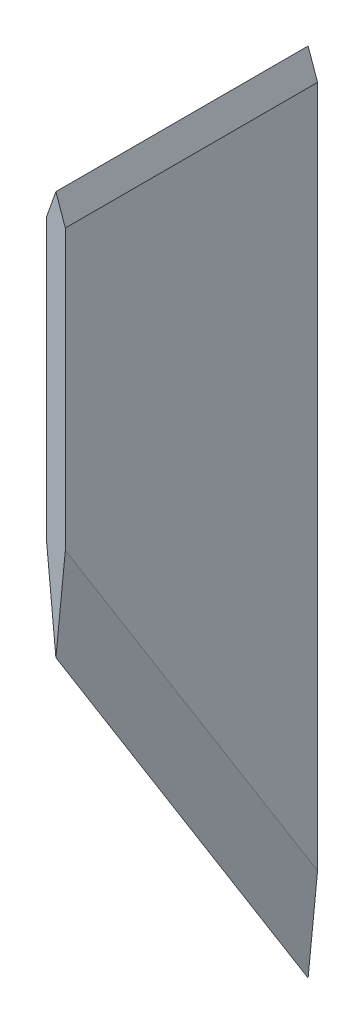
from build123d import *

# Parameters (mm, degrees)
BOSS_EXTRUDE1_DEPTH     = 4.7625
CUT_EXTRUDE1_DEPTH      = 120.906177515
CUT_EXTRUDE1_DEPTH_BACK = 120.906177515
CUT_EXTRUDE2_DEPTH      = 213.944056987
CUT_EXTRUDE2_DEPTH_BACK = 213.944056987


with BuildPart() as part:
    # Sketch1 → Boss-Extrude1 (new body)
    with BuildSketch(Plane.YZ):
        Polygon((0, 0), (203.2, 0), (203.2, 63.5), (101.6, 63.5), align=None)
    extrude(amount=BOSS_EXTRUDE1_DEPTH)

    # Sketch2 → Cut-Extrude1 (cut, two sides: drawn at the far end of the back side and taken through both)
    with BuildSketch(Plane(origin=(0, 101.6, 63.5), x_dir=(-1, 0, 0), z_dir=(0, 0.8479983040050881, 0.52999894000318)).offset(-CUT_EXTRUDE1_DEPTH_BACK)):
        Polygon((-4.7625, -13.025620451), (-4.7625, 1.50596977), (0, 1.50596977), (0, -13.025620451), (-2.38125, 0), align=None)
    extrude(amount=CUT_EXTRUDE1_DEPTH + CUT_EXTRUDE1_DEPTH_BACK, mode=Mode.SUBTRACT)

    # Sketch3 → Cut-Extrude2 (cut, two sides: drawn at the far end of the back side and taken through both)
    with BuildSketch(Plane.XY.offset(63.5).offset(-CUT_EXTRUDE2_DEPTH_BACK)):
        Polygon((0, 196.460608551), (2.38125, 203.2), (4.7625, 196.460608551), (4.7625, 209.769975366), (0, 209.769975366), align=None)
    extrude(amount=CUT_EXTRUDE2_DEPTH + CUT_EXTRUDE2_DEPTH_BACK, mode=Mode.SUBTRACT)


solid = part.part
